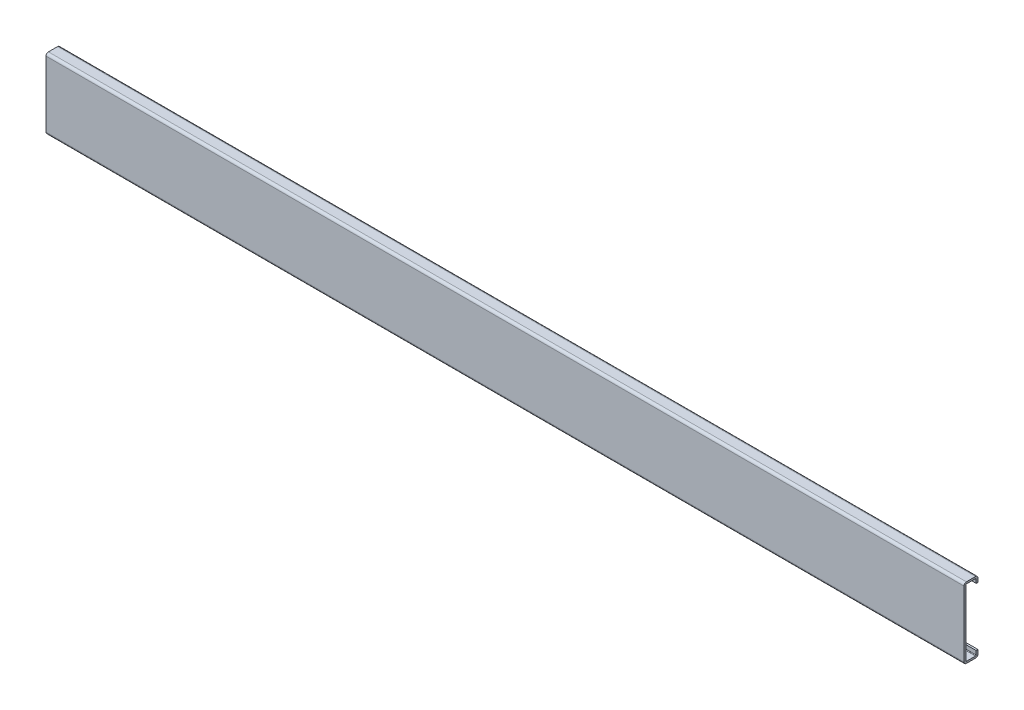
from build123d import *

# Parameters (mm, degrees)
EXTRUDE_1_DEPTH = 600


with BuildPart() as part:
    # Эскиз1 → Вытянуть-Тонкостенный1 (new body)
    with BuildSketch(Plane(origin=(0, 0, 0), x_dir=(0, 0, -1), z_dir=(1, 0, 0))):
        with BuildLine():
            Line((7.4, -19), (7.4, -21.5))
            ThreePointArc((7.4, -21.5), (7.282842712, -21.782842712), (7, -21.9))
            Line((7, -21.9), (1, -21.9))
            ThreePointArc((1, -21.9), (0.717157288, -21.782842712), (0.6, -21.5))
            Line((0.6, -21.5), (0.6, 21.5))
            ThreePointArc((0.6, 21.5), (0.717157288, 21.782842712), (1, 21.9))
            Line((1, 21.9), (7, 21.9))
            ThreePointArc((7, 21.9), (7.282842712, 21.782842712), (7.4, 21.5))
            Line((7.4, 21.5), (7.4, 19))
            Line((7.4, 19), (8.6, 19))
            Line((8.6, 19), (8.6, 21.5))
            ThreePointArc((8.6, 21.5), (8.13137085, 22.63137085), (7, 23.1))
            Line((7, 23.1), (1, 23.1))
            ThreePointArc((1, 23.1), (-0.13137085, 22.63137085), (-0.6, 21.5))
            Line((-0.6, 21.5), (-0.6, -21.5))
            ThreePointArc((-0.6, -21.5), (-0.13137085, -22.63137085), (1, -23.1))
            Line((1, -23.1), (7, -23.1))
            ThreePointArc((7, -23.1), (8.13137085, -22.63137085), (8.6, -21.5))
            Line((8.6, -21.5), (8.6, -19))
            Line((8.6, -19), (7.4, -19))
        make_face()
    extrude(amount=EXTRUDE_1_DEPTH)


solid = part.part
